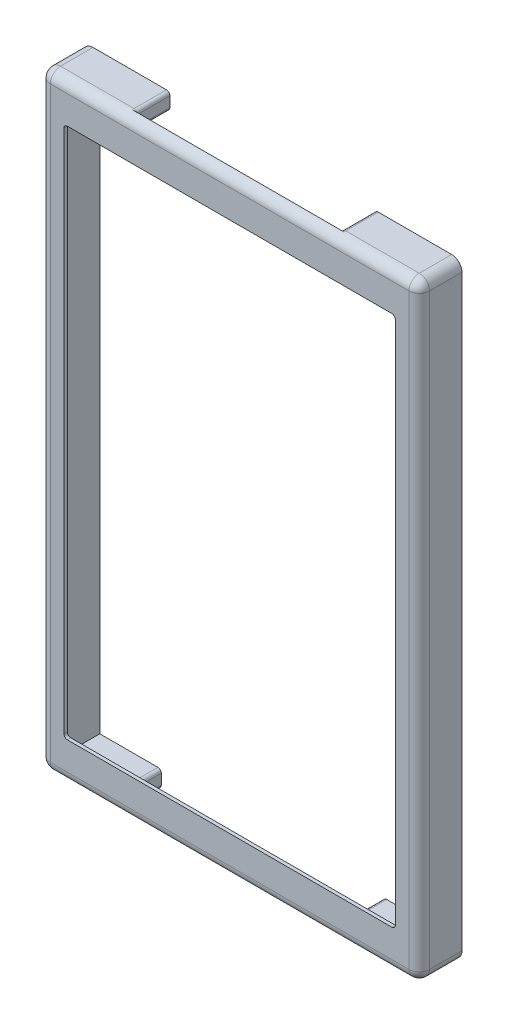
from build123d import *

# Parameters (mm, degrees)
SKETCH1_W           = 111
SKETCH1_H           = 178
SKETCH1_W_2         = 101
SKETCH1_H_2         = 168
BOSS_EXTRUDE1_DEPTH = 6
SKETCH2_W           = 111
SKETCH2_H           = 178
SKETCH2_W_2         = 97
SKETCH2_H_2         = 155.54954955
BOSS_EXTRUDE2_DEPTH = 0.5
SKETCH3_W           = 60
SKETCH3_H           = 10
CUT_EXTRUDE1_DEPTH  = 77
SKETCH4_W           = 65
SKETCH4_H           = 10
CUT_EXTRUDE2_DEPTH  = 77
FILLET1_R           = 1
FILLET2_R           = 3
FILLET3_R           = 1


with BuildPart() as part:
    # Sketch1 → Boss-Extrude1 (new, symmetric)
    with BuildSketch(Plane.XY):
        Rectangle(SKETCH1_W, SKETCH1_H)
        Rectangle(SKETCH1_W_2, SKETCH1_H_2, mode=Mode.SUBTRACT)
    extrude(amount=BOSS_EXTRUDE1_DEPTH, both=True)

    # Sketch2 → Boss-Extrude2 (add, symmetric)
    with BuildSketch(Plane.XY.offset(6)):
        Rectangle(SKETCH2_W, SKETCH2_H)
        Rectangle(SKETCH2_W_2, SKETCH2_H_2, mode=Mode.SUBTRACT)
    extrude(amount=BOSS_EXTRUDE2_DEPTH, both=True)

    # Sketch3 → Cut-Extrude1 (cut)
    with BuildSketch(Plane.XZ.offset(-84)):
        with Locations((0, -1)):
            Rectangle(SKETCH3_W, SKETCH3_H)
    extrude(amount=-CUT_EXTRUDE1_DEPTH, mode=Mode.SUBTRACT)

    # Sketch4 → Cut-Extrude2 (cut)
    with BuildSketch(Plane(origin=(0, -84, 0), x_dir=(1, 0, 0), z_dir=(0, 1, 0))):
        with Locations((0, 6)):
            Rectangle(SKETCH4_W, SKETCH4_H)
    extrude(amount=-CUT_EXTRUDE2_DEPTH, mode=Mode.SUBTRACT)

    # Fillet1
    fillet1_edges = [part.edges().sort_by_distance(p)[0] for p in [
        (-48.5, -77.774774775, 6),
        (48.5, -77.774774775, 6),
        (48.5, 77.774774775, 6),
        (-48.5, 77.774774775, 6),
    ]]
    fillet(fillet1_edges, radius=FILLET1_R)

    # Fillet2
    # the kernel refuses this fillet: 3 mm, written as the material it takes off along each edge
    with BuildSketch(Plane(origin=(-52.5, -86, 3.5), x_dir=(0, -1, 0), z_dir=(0, 0, 1))) as fillet2_piece_1_section:
        Polygon((0, 0), (FILLET2_R, 0), (FILLET2_R, -FILLET2_R), (0, -FILLET2_R), align=None)
    fillet2_piece_1 = extrude(amount=FILLET2_R, mode=Mode.PRIVATE)
    fillet2_piece_1 = fillet2_piece_1 - Plane(origin=(-52.5, -86, 3.5), x_dir=(0.7071067811865475, 0.7071067811865477, 0), z_dir=(0, 0, 1)) * Sphere(FILLET2_R, mode=Mode.PRIVATE)
    add(fillet2_piece_1, mode=Mode.SUBTRACT)
    with BuildSketch(Plane(origin=(-52.5, 86, 3.5), x_dir=(-1, 0, 0), z_dir=(0, 0, 1))) as fillet2_piece_2_section:
        Polygon((0, 0), (FILLET2_R, 0), (FILLET2_R, -FILLET2_R), (0, -FILLET2_R), align=None)
    fillet2_piece_2 = extrude(amount=FILLET2_R, mode=Mode.PRIVATE)
    fillet2_piece_2 = fillet2_piece_2 - Plane(origin=(-52.5, 86, 3.5), x_dir=(0.7071067811865477, -0.7071067811865474, 0), z_dir=(0, 0, 1)) * Sphere(FILLET2_R, mode=Mode.PRIVATE)
    add(fillet2_piece_2, mode=Mode.SUBTRACT)
    with BuildSketch(Plane(origin=(52.5, -86, 3.5), x_dir=(0, -1, 0), z_dir=(0, 0, 1))) as fillet2_piece_3_section:
        Polygon((0, 0), (FILLET2_R, 0), (FILLET2_R, FILLET2_R), (0, FILLET2_R), align=None)
    fillet2_piece_3 = extrude(amount=FILLET2_R, mode=Mode.PRIVATE)
    fillet2_piece_3 = fillet2_piece_3 - Plane(origin=(52.5, -86, 3.5), x_dir=(-0.7071067811865476, 0.7071067811865475, 0), z_dir=(0, 0, 1)) * Sphere(FILLET2_R, mode=Mode.PRIVATE)
    add(fillet2_piece_3, mode=Mode.SUBTRACT)
    with BuildSketch(Plane(origin=(52.5, 86, 3.5), x_dir=(0, 1, 0), z_dir=(0, 0, 1))) as fillet2_piece_4_section:
        Polygon((0, 0), (FILLET2_R, 0), (FILLET2_R, -FILLET2_R), (0, -FILLET2_R), align=None)
    fillet2_piece_4 = extrude(amount=FILLET2_R, mode=Mode.PRIVATE)
    fillet2_piece_4 = fillet2_piece_4 - Plane(origin=(52.5, 86, 3.5), x_dir=(-0.7071067811865474, -0.7071067811865477, 0), z_dir=(0, 0, 1)) * Sphere(FILLET2_R, mode=Mode.PRIVATE)
    add(fillet2_piece_4, mode=Mode.SUBTRACT)
    with BuildSketch(Plane(origin=(-55.5, -86, 6.5), x_dir=(1, 0, 0), z_dir=(0, 1, 0)), Plane(origin=(55.5, 86, 6.5), x_dir=(-1, 0, 0), z_dir=(0, -1, 0))) as fillet2_piece_5:
        with BuildLine():
            CenterArc((FILLET2_R, FILLET2_R), FILLET2_R, 180, 90)
            Line((0, FILLET2_R), (0, 0))
            Line((0, 0), (FILLET2_R, 0))
        make_face()
    extrude(amount=172, mode=Mode.SUBTRACT)
    with BuildSketch(Plane(origin=(52.5, -89, 6.5), x_dir=(0, 1, 0), z_dir=(-1, 0, 0)), Plane(origin=(-52.5, 89, 6.5), x_dir=(0, -1, 0), z_dir=(1, 0, 0))) as fillet2_piece_6:
        with BuildLine():
            CenterArc((FILLET2_R, FILLET2_R), FILLET2_R, 180, 90)
            Line((0, FILLET2_R), (0, 0))
            Line((0, 0), (FILLET2_R, 0))
        make_face()
    extrude(amount=105, mode=Mode.SUBTRACT)
    with BuildSketch(Plane(origin=(55.5, 89, -13.5), x_dir=(-1, 0, 0), z_dir=(0, 0, 1))) as fillet2_piece_7:
        with BuildLine():
            CenterArc((FILLET2_R, FILLET2_R), FILLET2_R, 180, 90)
            Line((0, FILLET2_R), (0, 0))
            Line((0, 0), (FILLET2_R, 0))
        make_face()
    extrude(amount=17, mode=Mode.SUBTRACT)
    with BuildSketch(Plane(origin=(-55.5, 89, 3.5), x_dir=(0, -1, 0), z_dir=(0, 0, -1)), Plane(origin=(55.5, -89, -13.5), x_dir=(-1, 0, 0), z_dir=(0, 0, 1)), Plane(origin=(-55.5, -89, 3.5), x_dir=(1, 0, 0), z_dir=(0, 0, -1))) as fillet2_piece_8:
        with BuildLine():
            CenterArc((FILLET2_R, -FILLET2_R), FILLET2_R, 90, 90)
            Line((0, -FILLET2_R), (0, 0))
            Line((0, 0), (FILLET2_R, 0))
        make_face()
    extrude(amount=17, mode=Mode.SUBTRACT)

    # Fillet3
    fillet3_edges = [part.edges().sort_by_distance(p)[0] for p in [
        (-30, 89, -1.25),
        (-30, 88.989491568, 3.750878781),
        (30, 88.989491568, 3.750878781),
        (30, 89, -1.25),
        (-30, 84, -1),
        (30, 84, -1),
        (0, 84, 4),
        (0, -89, -1),
        (32.5, -89, -3.5),
        (-32.5, -89, -3.5),
        (32.5, -84, -3.5),
        (-32.5, -84, -3.5),
        (0, -84, -1),
    ]]
    fillet(fillet3_edges, radius=FILLET3_R)


solid = part.part
